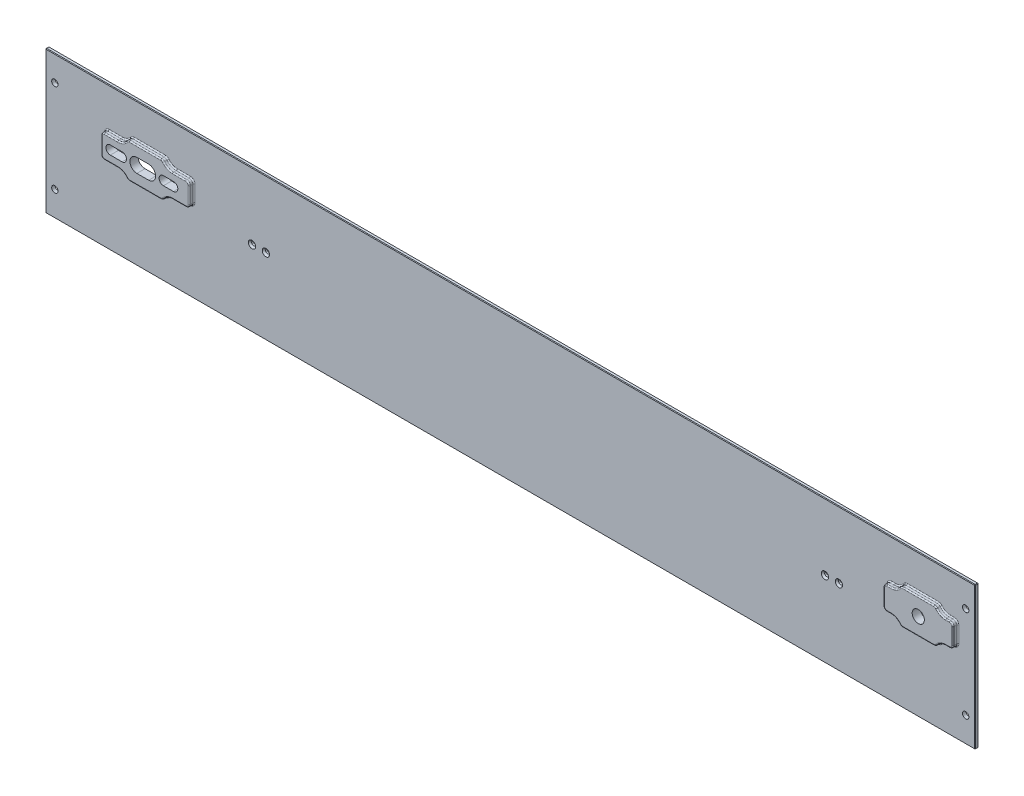
from build123d import *

# Parameters (mm, degrees)
SKETCH1_W                                           = 801.51
SKETCH1_H                                           = 123
SKETCH1_R                                           = 6
SKETCH1_R_2                                         = 5.25
BOSS_EXTRUDE1_DEPTH                                 = 3
BOSS_EXTRUDE2_DEPTH                                 = 4
SKETCH3_R                                           = 2.75
CUT_EXTRUDE1_DEPTH                                  = 428.790597168
FILLET1_R                                           = 10
FILLET2_R                                           = 3
FILLET3_R                                           = 1
CHAMFER1_SIZE                                       = 0.5
FILLET4_R                                           = 10
FILLET5_R                                           = 3
FILLET6_R                                           = 1
CUT_EXTRUDE2_DEPTH                                  = 428.790597169
SKETCH5_R                                           = 5.25
CUT_EXTRUDE3_DEPTH                                  = 10
CSK_FOR_M3_COUNTERSUNK_FLAT_HEAD_SCREW2_D           = 3.4
CSK_FOR_M3_COUNTERSUNK_FLAT_HEAD_SCREW2_DEPTH       = 30
CSK_FOR_M3_COUNTERSUNK_FLAT_HEAD_SCREW2_CSINK_D     = 6.3
CSK_FOR_M3_COUNTERSUNK_FLAT_HEAD_SCREW2_CSINK_ANGLE = 90
CSK_FOR_M3_COUNTERSUNK_FLAT_HEAD_SCREW2_TIP         = 1.021463052


with BuildPart() as part:
    # Sketch1 → Boss-Extrude1 (new body)
    with BuildSketch(Plane.XY):
        with Locations((-22.5, -0.5)):
            Rectangle(SKETCH1_W, SKETCH1_H)
        with Locations((-333.255, 17)):
            Circle(SKETCH1_R, mode=Mode.SUBTRACT)
        with Locations((333.255, 17)):
            Circle(SKETCH1_R_2, mode=Mode.SUBTRACT)
    extrude(amount=BOSS_EXTRUDE1_DEPTH)

    # Sketch4 → Boss-Extrude2 (add)
    # profile 1 of 2: a face of its own
    with BuildSketch(Plane.XY.offset(3)):
        Polygon((-318.255, 27), (-295.255, 27), (-295.255, 7), (-318.255, 7), (-318.255, 2), (-348.255, 2), (-348.255, 7), (-371.255, 7), (-371.255, 27), (-348.255, 27), (-348.255, 32), (-318.255, 32), align=None)
        with BuildLine():
            Line((-340.395, 23), (-330.255, 23))
            ThreePointArc((-330.255, 23), (-324.255, 17), (-330.255, 11))
            Line((-330.255, 11), (-340.395, 11))
            ThreePointArc((-340.395, 11), (-346.395, 17), (-340.395, 23))
        make_face(mode=Mode.SUBTRACT)
        with BuildLine():
            Line((-317.505, 20.75), (-308.865, 20.75))
            ThreePointArc((-308.865, 20.75), (-305.115, 17), (-308.865, 13.25))
            Line((-308.865, 13.25), (-317.505, 13.25))
            ThreePointArc((-317.505, 13.25), (-321.255, 17), (-317.505, 20.75))
        make_face(mode=Mode.SUBTRACT)
        with BuildLine():
            Line((-353.145, 13.25), (-363.285, 13.25))
            ThreePointArc((-363.285, 13.25), (-367.035, 17), (-363.285, 20.75))
            Line((-363.285, 20.75), (-353.145, 20.75))
            ThreePointArc((-353.145, 20.75), (-349.395, 17), (-353.145, 13.25))
        make_face(mode=Mode.SUBTRACT)
    # profile 2 of 2: a face of its own
    with BuildSketch(Plane.XY.offset(3)):
        Polygon((318.255, 32), (348.255, 32), (348.255, 27), (363.255, 27), (363.255, 7), (348.255, 7), (348.255, 2), (318.255, 2), (318.255, 7), (303.255, 7), (303.255, 27), (318.255, 27), align=None)
    extrude(amount=BOSS_EXTRUDE2_DEPTH)

    # Sketch3 → Cut-Extrude1 (cut, symmetric)
    with BuildSketch(Plane.XY.offset(3)):
        with Locations((370.105, 39.25)):
            Circle(SKETCH3_R)
        with Locations((370.105, -40.25)):
            Circle(SKETCH3_R)
    cut_extrude1 = extrude(amount=CUT_EXTRUDE1_DEPTH, both=True, mode=Mode.SUBTRACT)

    # Mirror3: Cut-Extrude1 across plane
    add(cut_extrude1.mirror(Plane(origin=(-22.5, 0, 0), x_dir=(0, 0, 1), z_dir=(1, 0, 0))), mode=Mode.SUBTRACT)

    # Fillet1
    # the kernel refuses this fillet: 10 mm, written as the material it adds along each edge
    with BuildSketch(Plane(origin=(-318.255, 7, 3), x_dir=(1, 0, 0), z_dir=(0, 0, 1))) as fillet1_piece_1:
        with BuildLine():
            CenterArc((8.660254038, -10), FILLET1_R, 90, 60)
            Line((0, -5), (-0.173205081, -4.9))
            ThreePointArc((-0.173205081, -4.9), (-0.2, -2.5), (-0.2, 0))
            Line((-0.2, 0), (0, 0.2))
            Line((0, 0.2), (8.660254038, 0.2))
            Line((8.660254038, 0.2), (8.660254038, 0))
        make_face()
    extrude(amount=4)
    with BuildSketch(Plane(origin=(-348.255, 7, 3), x_dir=(0, -1, 0), z_dir=(0, 0, 1))) as fillet1_piece_2:
        with BuildLine():
            CenterArc((10, -8.660254038), FILLET1_R, 120, 60)
            Line((0, -8.660254038), (-0.2, -8.660254038))
            Line((-0.2, -8.660254038), (-0.2, 0))
            Line((-0.2, 0), (0, 0.2))
            ThreePointArc((0, 0.2), (2.5, 0.2), (4.9, 0.173205081))
            Line((4.9, 0.173205081), (5, 0))
        make_face()
    extrude(amount=4)
    with BuildSketch(Plane(origin=(-348.255, 27, 3), x_dir=(0, 1, 0), z_dir=(0, 0, 1))) as fillet1_piece_3:
        with BuildLine():
            CenterArc((10, 8.660254038), FILLET1_R, 180, 60)
            Line((0, 8.660254038), (-0.2, 8.660254038))
            Line((-0.2, 8.660254038), (-0.2, 0))
            Line((-0.2, 0), (0, -0.2))
            ThreePointArc((0, -0.2), (2.5, -0.2), (4.9, -0.173205081))
            Line((4.9, -0.173205081), (5, 0))
        make_face()
    extrude(amount=4)
    with BuildSketch(Plane(origin=(-318.255, 27, 3), x_dir=(1, 0, 0), z_dir=(0, 0, 1))) as fillet1_piece_4:
        with BuildLine():
            CenterArc((8.660254038, 10), FILLET1_R, 210, 60)
            Line((0, 5), (-0.173205081, 4.9))
            ThreePointArc((-0.173205081, 4.9), (-0.2, 2.5), (-0.2, 0))
            Line((-0.2, 0), (0, -0.2))
            Line((0, -0.2), (8.660254038, -0.2))
            Line((8.660254038, -0.2), (8.660254038, 0))
        make_face()
    extrude(amount=4)

    # Fillet2
    fillet2_edges = [part.edges().sort_by_distance(p)[0] for p in [
        (-318.255, 2, 5),
        (-295.255, 7, 5),
        (-295.255, 27, 5),
        (-318.255, 32, 5),
        (-348.255, 32, 5),
        (-371.255, 27, 5),
        (-371.255, 7, 5),
        (-348.255, 2, 5),
    ]]
    fillet(fillet2_edges, radius=FILLET2_R)

    # Fillet3
    fillet3_edges = [part.edges().sort_by_distance(p)[0] for p in [
        (-303.924872981, 7, 3),
        (-303.924872981, 7, 7),
        (-362.585127019, 27, 3),
        (-352.529963941, 28.012829657, 3),
        (-313.980036059, 5.987170343, 3),
        (-362.585127019, 27, 7),
        (-352.529963941, 5.987170343, 7),
        (-313.980036059, 28.012829657, 7),
        (-333.255, 2, 3),
        (-333.255, 2, 7),
        (-352.529963941, 5.987170343, 3),
        (-313.980036059, 5.987170343, 7),
        (-295.255, 17, 7),
        (-303.924872981, 27, 7),
        (-333.255, 32, 7),
        (-352.529963941, 28.012829657, 7),
        (-371.255, 17, 7),
        (-362.585127019, 7, 7),
        (-370.376320344, 26.121320344, 7),
        (-370.376320344, 7.878679656, 7),
        (-296.133679656, 7.878679656, 7),
        (-296.133679656, 26.121320344, 7),
        (-347.983890301, 31.696151103, 7),
        (-318.526109699, 31.696151103, 7),
        (-318.526109699, 2.303848897, 7),
        (-347.983890301, 2.303848897, 7),
        (-333.255, 32, 3),
        (-313.980036059, 28.012829657, 3),
        (-303.924872981, 27, 3),
        (-295.255, 17, 3),
        (-362.585127019, 7, 3),
        (-371.255, 17, 3),
        (-347.983890301, 2.303848897, 3),
        (-318.526109699, 2.303848897, 3),
        (-318.526109699, 31.696151103, 3),
        (-347.983890301, 31.696151103, 3),
        (-296.133679656, 26.121320344, 3),
        (-296.133679656, 7.878679656, 3),
        (-370.376320344, 7.878679656, 3),
        (-370.376320344, 26.121320344, 3),
    ]]
    fillet(fillet3_edges, radius=FILLET3_R)

    # Chamfer1
    chamfer1_edges = [part.edges().sort_by_distance(p)[0] for p in [
        (-423.255, -0.5, 3),
        (-22.5, -62, 3),
        (378.255, -0.5, 3),
        (-22.5, -62, 0),
        (-423.255, -0.5, 0),
        (-22.5, 61, 0),
        (378.255, -0.5, 0),
        (378.255, -62, 1.5),
        (-423.255, -62, 1.5),
        (-423.255, 61, 1.5),
        (378.255, 61, 1.5),
        (-22.5, 61, 3),
    ]]
    chamfer(chamfer1_edges, length=CHAMFER1_SIZE)

    # Fillet4
    # the kernel refuses this fillet: 10 mm, written as the material it adds along each edge
    with BuildSketch(Plane(origin=(348.255, 7, 3), x_dir=(1, 0, 0), z_dir=(0, 0, 1))) as fillet4_piece_1:
        with BuildLine():
            CenterArc((8.660254038, -10), FILLET4_R, 90, 60)
            Line((0, -5), (-0.173205081, -4.9))
            ThreePointArc((-0.173205081, -4.9), (-0.2, -2.5), (-0.2, 0))
            Line((-0.2, 0), (0, 0.2))
            Line((0, 0.2), (8.660254038, 0.2))
            Line((8.660254038, 0.2), (8.660254038, 0))
        make_face()
    extrude(amount=4)
    with BuildSketch(Plane(origin=(318.255, 7, 3), x_dir=(-1, 0, 0), z_dir=(0, 0, 1))) as fillet4_piece_2:
        with BuildLine():
            CenterArc((8.660254038, 10), FILLET4_R, 210, 60)
            Line((0, 5), (-0.173205081, 4.9))
            ThreePointArc((-0.173205081, 4.9), (-0.2, 2.5), (-0.2, 0))
            Line((-0.2, 0), (0, -0.2))
            Line((0, -0.2), (8.660254038, -0.2))
            Line((8.660254038, -0.2), (8.660254038, 0))
        make_face()
    extrude(amount=4)
    with BuildSketch(Plane(origin=(318.255, 27, 3), x_dir=(0, 1, 0), z_dir=(0, 0, 1))) as fillet4_piece_3:
        with BuildLine():
            CenterArc((10, 8.660254038), FILLET4_R, 180, 60)
            Line((0, 8.660254038), (-0.2, 8.660254038))
            Line((-0.2, 8.660254038), (-0.2, 0))
            Line((-0.2, 0), (0, -0.2))
            ThreePointArc((0, -0.2), (2.5, -0.2), (4.9, -0.173205081))
            Line((4.9, -0.173205081), (5, 0))
        make_face()
    extrude(amount=4)
    with BuildSketch(Plane(origin=(348.255, 27, 3), x_dir=(0, 1, 0), z_dir=(0, 0, 1))) as fillet4_piece_4:
        with BuildLine():
            CenterArc((10, -8.660254038), FILLET4_R, 120, 60)
            Line((0, -8.660254038), (-0.2, -8.660254038))
            Line((-0.2, -8.660254038), (-0.2, 0))
            Line((-0.2, 0), (0, 0.2))
            ThreePointArc((0, 0.2), (2.5, 0.2), (4.9, 0.173205081))
            Line((4.9, 0.173205081), (5, 0))
        make_face()
    extrude(amount=4)

    # Fillet5
    fillet5_edges = [part.edges().sort_by_distance(p)[0] for p in [
        (348.255, 2, 5),
        (363.255, 7, 5),
        (363.255, 27, 5),
        (348.255, 32, 5),
        (318.255, 32, 5),
        (303.255, 27, 5),
        (303.255, 7, 5),
        (318.255, 2, 5),
    ]]
    fillet(fillet5_edges, radius=FILLET5_R)

    # Fillet6
    fillet6_edges = [part.edges().sort_by_distance(p)[0] for p in [
        (358.585127019, 7, 3),
        (358.585127019, 7, 7),
        (307.924872981, 27, 3),
        (313.980036059, 28.012829657, 3),
        (352.529963941, 5.987170343, 3),
        (307.924872981, 27, 7),
        (313.980036059, 5.987170343, 7),
        (352.529963941, 28.012829657, 7),
        (307.924872981, 7, 3),
        (307.924872981, 7, 7),
        (303.255, 17, 3),
        (303.255, 17, 7),
        (333.255, 2, 7),
        (352.529963941, 5.987170343, 7),
        (363.255, 17, 7),
        (358.585127019, 27, 7),
        (333.255, 32, 7),
        (313.980036059, 28.012829657, 7),
        (304.133679656, 26.121320344, 7),
        (318.526109699, 31.696151103, 7),
        (347.983890301, 31.696151103, 7),
        (362.376320344, 26.121320344, 7),
        (362.376320344, 7.878679656, 7),
        (347.983890301, 2.303848897, 7),
        (318.526109699, 2.303848897, 7),
        (304.133679656, 7.878679656, 7),
        (333.255, 2, 3),
        (313.980036059, 5.987170343, 3),
        (363.255, 17, 3),
        (358.585127019, 27, 3),
        (333.255, 32, 3),
        (352.529963941, 28.012829657, 3),
        (304.133679656, 7.878679656, 3),
        (318.526109699, 2.303848897, 3),
        (347.983890301, 2.303848897, 3),
        (362.376320344, 7.878679656, 3),
        (362.376320344, 26.121320344, 3),
        (347.983890301, 31.696151103, 3),
        (318.526109699, 31.696151103, 3),
        (304.133679656, 26.121320344, 3),
    ]]
    fillet(fillet6_edges, radius=FILLET6_R)

    # Sketch4<2> → Cut-Extrude2 (cut, through all)
    with BuildSketch(Plane.XY.offset(3)):
        with BuildLine():
            Line((-333.255, 23), (-340.395, 23))
            ThreePointArc((-340.395, 23), (-346.395, 17), (-340.395, 11))
            Line((-340.395, 11), (-333.255, 11))
            ThreePointArc((-333.255, 11), (-339.255, 17), (-333.255, 23))
        make_face()
        with BuildLine():
            Line((-330.255, 23), (-333.255, 23))
            ThreePointArc((-333.255, 23), (-327.255, 17), (-333.255, 11))
            Line((-333.255, 11), (-330.255, 11))
            ThreePointArc((-330.255, 11), (-324.255, 17), (-330.255, 23))
        make_face()
        with BuildLine():
            Line((-308.865, 20.75), (-317.505, 20.75))
            ThreePointArc((-317.505, 20.75), (-321.255, 17), (-317.505, 13.25))
            Line((-317.505, 13.25), (-308.865, 13.25))
            ThreePointArc((-308.865, 13.25), (-305.115, 17), (-308.865, 20.75))
        make_face()
        with BuildLine():
            Line((-363.285, 13.25), (-353.145, 13.25))
            ThreePointArc((-353.145, 13.25), (-349.395, 17), (-353.145, 20.75))
            Line((-353.145, 20.75), (-363.285, 20.75))
            ThreePointArc((-363.285, 20.75), (-367.035, 17), (-363.285, 13.25))
        make_face()
    extrude(amount=-CUT_EXTRUDE2_DEPTH, mode=Mode.SUBTRACT)

    # Sketch5 → Cut-Extrude3 (cut)
    with BuildSketch(Plane(origin=(0, 0, 3), x_dir=(-1, 0, 0), z_dir=(0, 0, -1))):
        with Locations(Location((-333.255, 17, 0), (0, 0, 180))):
            Circle(SKETCH5_R)
    extrude(amount=-CUT_EXTRUDE3_DEPTH, mode=Mode.SUBTRACT)

    # CSK for M3 Countersunk Flat Head Screw2
    with Locations(Plane.XY.offset(3)):
        with Locations((-233.156936194, 3.5), (-245.156936194, 3.5), (260.843063806, 3.5), (248.843063806, 3.5)):
            CounterSinkHole(CSK_FOR_M3_COUNTERSUNK_FLAT_HEAD_SCREW2_D / 2, CSK_FOR_M3_COUNTERSUNK_FLAT_HEAD_SCREW2_CSINK_D / 2, depth=CSK_FOR_M3_COUNTERSUNK_FLAT_HEAD_SCREW2_DEPTH, counter_sink_angle=CSK_FOR_M3_COUNTERSUNK_FLAT_HEAD_SCREW2_CSINK_ANGLE)
            with Locations((0, 0, -(CSK_FOR_M3_COUNTERSUNK_FLAT_HEAD_SCREW2_DEPTH + CSK_FOR_M3_COUNTERSUNK_FLAT_HEAD_SCREW2_TIP / 2))):  # 118° drill point
                Cone(0, CSK_FOR_M3_COUNTERSUNK_FLAT_HEAD_SCREW2_D / 2, CSK_FOR_M3_COUNTERSUNK_FLAT_HEAD_SCREW2_TIP, mode=Mode.SUBTRACT)


solid = part.part
